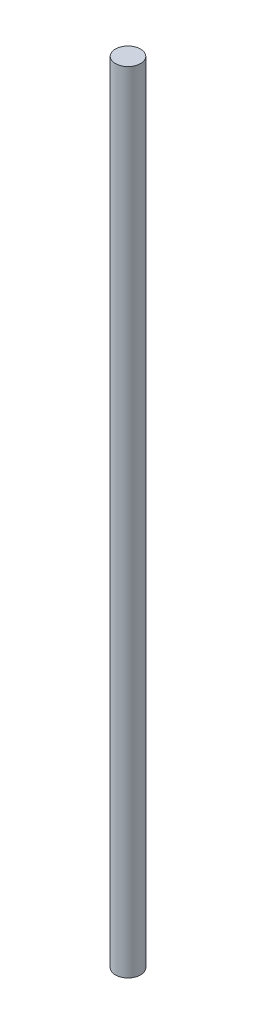
from build123d import *

# Parameters (mm, degrees)
SKETCH1_R           = 4.7625
BOSS_EXTRUDE1_DEPTH = 298.45


with BuildPart() as part:
    # Sketch1 → Boss-Extrude1 (new body)
    with BuildSketch(Plane(origin=(0, 0, 0), x_dir=(1, 0, 0), z_dir=(0, 1, 0))):
        Circle(SKETCH1_R)
    extrude(amount=BOSS_EXTRUDE1_DEPTH)


solid = part.part
